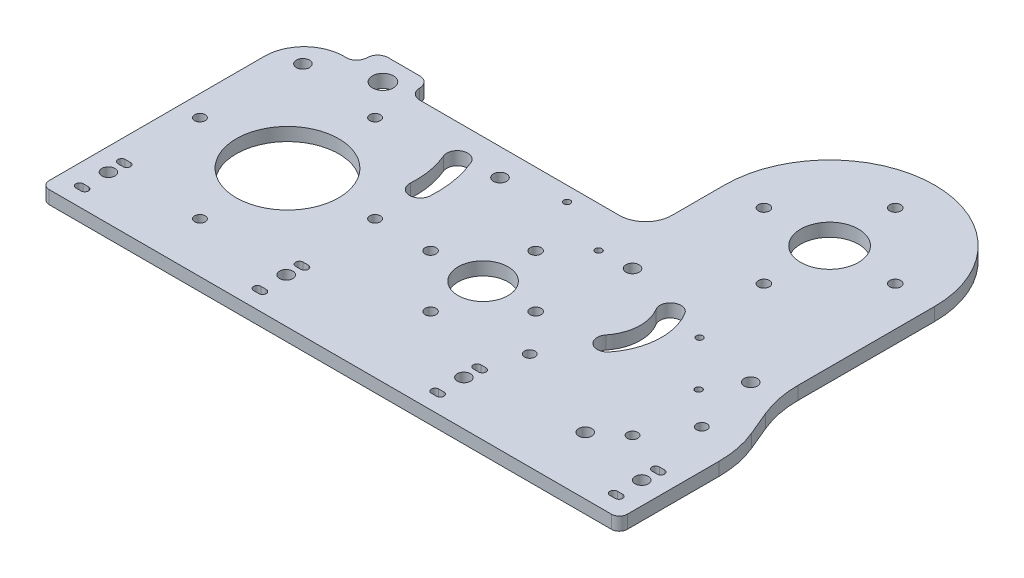
from build123d import *

# Parameters (mm, degrees)
SKETCH1_R           = 19.5
SKETCH1_R_2         = 2.1
SKETCH1_R_3         = 2
SKETCH1_R_4         = 2.5
SKETCH1_R_5         = 9.5
SKETCH1_R_6         = 1.25
SKETCH1_R_7         = 11
BOSS_EXTRUDE1_DEPTH = 5
SKETCH15_R          = 2
CUT_EXTRUDE14_DEPTH = 10
SKETCH18_R          = 2.5
CUT_EXTRUDE15_DEPTH = 483.844656179
FILLET2_R           = 40
FILLET3_R           = 40
SKETCH21_W          = 20
SKETCH21_H          = 8
BOSS_EXTRUDE3_DEPTH = 5
SKETCH20_R          = 4
CUT_EXTRUDE17_DEPTH = 279.07373123
FILLET4_R           = 4
FILLET5_R           = 3


with BuildPart() as part:
    # Sketch1 → Boss-Extrude1 (new body)
    with BuildSketch(Plane(origin=(0, 0, 0), x_dir=(1, 0, 0), z_dir=(0, 1, 0))):
        with BuildLine():
            Line((0, 85), (0, 0))
            Line((0, 0), (220, 0))
            Line((220, 0), (220, 46))
            Line((220, 46), (210, 70))
            Line((210, 70), (210, 130))
            ThreePointArc((210, 130), (170, 170), (130, 130))
            Line((130, 130), (130, 110))
            ThreePointArc((130, 110), (127.071067812, 102.928932188), (120, 100))
            Line((120, 100), (15, 100))
            ThreePointArc((15, 100), (4.393398282, 95.606601718), (0, 85))
        make_face()
        with Locations(Location((41.3, 52.378949376, 0), (0, 0, 270))):
            Circle(SKETCH1_R, mode=Mode.SUBTRACT)
        with Locations(Location((95.75, 52.378949376, 0), (0, 0, 270))):
            Circle(SKETCH1_R_2, mode=Mode.SUBTRACT)
        with BuildLine():
            ThreePointArc((74.29628188, 89.247443853), (77.033008956, 80.00277522), (77.543356768, 70.375048681))
            ThreePointArc((77.543356768, 70.375048681), (73.293969575, 66.641055044), (69.559975938, 70.890442238))
            ThreePointArc((69.559975938, 70.890442238), (69.148853816, 78.646273201), (66.944221964, 86.093523278))
            ThreePointArc((66.944221964, 86.093523278), (69.043291634, 91.346513523), (74.29628188, 89.247443853))
        make_face(mode=Mode.SUBTRACT)
        with Locations(Location((115.75, 32.378949376, 0), (0, 0, 270))):
            Circle(SKETCH1_R_2, mode=Mode.SUBTRACT)
        with Locations(Location((148.636752457, 37.233182234, 0), (0, 0, 270))):
            Circle(SKETCH1_R_3, mode=Mode.SUBTRACT)
        with Locations(Location((185, 22, 0), (0, 0, 270))):
            Circle(SKETCH1_R_4, mode=Mode.SUBTRACT)
        with Locations(Location((195, 30, 0), (0, 0, 270))):
            Circle(SKETCH1_R_3, mode=Mode.SUBTRACT)
        with Locations(Location((115.75, 52.378949376, 0), (0, 0, 270))):
            Circle(SKETCH1_R_5, mode=Mode.SUBTRACT)
        with Locations(Location((135.75, 52.378949376, 0), (0, 0, 270))):
            Circle(SKETCH1_R_2, mode=Mode.SUBTRACT)
        with Locations(Location((115.75, 72.378949376, 0), (0, 0, 270))):
            Circle(SKETCH1_R_2, mode=Mode.SUBTRACT)
        with Locations(Location((127.63485968, 84.474011316, 0), (0, 0, 270))):
            Circle(SKETCH1_R_6, mode=Mode.SUBTRACT)
        with BuildLine():
            ThreePointArc((164.775508993, 80.152802956), (168.201540304, 66.369956658), (163.138904602, 53.100658923))
            ThreePointArc((163.138904602, 53.100658923), (157.520629535, 52.441124786), (156.861095398, 58.059399852))
            ThreePointArc((156.861095398, 58.059399852), (160.216140339, 66.853058501), (157.94568485, 75.987049461))
            ThreePointArc((157.94568485, 75.987049461), (159.277720174, 81.48483828), (164.775508993, 80.152802956))
        make_face(mode=Mode.SUBTRACT)
        with Locations(Location((140, 85, 0), (0, 0, 270))):
            Circle(SKETCH1_R_4, mode=Mode.SUBTRACT)
        with Locations(Location((192.472842847, 57.698975127, 0), (0, 0, 270))):
            Circle(SKETCH1_R_6, mode=Mode.SUBTRACT)
        with Locations(Location((205.365861758, 46, 0), (0, 0, 270))):
            Circle(SKETCH1_R_3, mode=Mode.SUBTRACT)
        with Locations(Location((175.551473485, 74.952011351, 0), (0, 0, 270))):
            Circle(SKETCH1_R_6, mode=Mode.SUBTRACT)
        with Locations(Location((200, 70, 0), (0, 0, 270))):
            Circle(SKETCH1_R_4, mode=Mode.SUBTRACT)
        with Locations(Location((9.83558927, 89.725342507, 0), (0, 0, 270))):
            Circle(SKETCH1_R_4, mode=Mode.SUBTRACT)
        with Locations(Location((84.83558927, 89.725342507, 0), (0, 0, 270))):
            Circle(SKETCH1_R_4, mode=Mode.SUBTRACT)
        with Locations(Location((105.63485968, 94.474011316, 0), (0, 0, 270))):
            Circle(SKETCH1_R_6, mode=Mode.SUBTRACT)
        with Locations(Location((170, 105, 0), (0, 0, 270))):
            Circle(SKETCH1_R_2, mode=Mode.SUBTRACT)
        with Locations(Location((145, 130, 0), (0, 0, 270))):
            Circle(SKETCH1_R_2, mode=Mode.SUBTRACT)
        with Locations(Location((170, 130, 0), (0, 0, 270))):
            Circle(SKETCH1_R_7, mode=Mode.SUBTRACT)
        with Locations(Location((195, 130, 0), (0, 0, 270))):
            Circle(SKETCH1_R_2, mode=Mode.SUBTRACT)
        with Locations(Location((170, 155, 0), (0, 0, 270))):
            Circle(SKETCH1_R_2, mode=Mode.SUBTRACT)
    extrude(amount=BOSS_EXTRUDE1_DEPTH)

    # Sketch15 → Cut-Extrude14 (cut)
    with BuildSketch(Plane(origin=(0, 5, 0), x_dir=(1, 0, 0), z_dir=(0, 1, 0))):
        with Locations(Location((41.3, 85.711963041, 0), (0, 0, 270))):
            Circle(SKETCH15_R)
        with Locations(Location((74.633013665, 52.378949376, 0), (0, 0, 270))):
            Circle(SKETCH15_R)
        with Locations(Location((41.3, 19.045935711, 0), (0, 0, 270))):
            Circle(SKETCH15_R)
        with Locations(Location((7.966986335, 52.378949376, 0), (0, 0, 270))):
            Circle(SKETCH15_R)
    extrude(amount=-CUT_EXTRUDE14_DEPTH, mode=Mode.SUBTRACT)

    # Sketch18 → Cut-Extrude15 (cut, through all)
    with BuildSketch(Plane(origin=(300.638016231, 0, 207.797227621), x_dir=(-1, 0, 0), z_dir=(0, -1, 0))):
        with Locations(Location((292.118016257, 224.797227621, 0), (0, 0, 90))):
            Circle(SKETCH18_R)
        with Locations(Location((224.458016257, 224.797227621, 0), (0, 0, 90))):
            Circle(SKETCH18_R)
        with Locations(Location((156.798016257, 224.797227621, 0), (0, 0, 90))):
            Circle(SKETCH18_R)
        with Locations(Location((89.138016257, 224.797227621, 0), (0, 0, 90))):
            Circle(SKETCH18_R)
        with BuildLine():
            Line((293.118016257, 229.397227621), (291.118016257, 229.397227621))
            ThreePointArc((291.118016257, 229.397227621), (289.718016257, 230.797227621), (291.118016257, 232.197227621))
            Line((291.118016257, 232.197227621), (293.118016257, 232.197227621))
            ThreePointArc((293.118016257, 232.197227621), (294.518016257, 230.797227621), (293.118016257, 229.397227621))
        make_face()
        with BuildLine():
            Line((293.118016257, 213.397227621), (291.118016257, 213.397227621))
            ThreePointArc((291.118016257, 213.397227621), (289.718016257, 214.797227621), (291.118016257, 216.197227621))
            Line((291.118016257, 216.197227621), (293.118016257, 216.197227621))
            ThreePointArc((293.118016257, 216.197227621), (294.518016257, 214.797227621), (293.118016257, 213.397227621))
        make_face()
        with BuildLine():
            Line((225.458016257, 229.397227621), (223.458016257, 229.397227621))
            ThreePointArc((223.458016257, 229.397227621), (222.058016257, 230.797227621), (223.458016257, 232.197227621))
            Line((223.458016257, 232.197227621), (225.458016257, 232.197227621))
            ThreePointArc((225.458016257, 232.197227621), (226.858016257, 230.797227621), (225.458016257, 229.397227621))
        make_face()
        with BuildLine():
            Line((225.458016257, 213.397227621), (223.458016257, 213.397227621))
            ThreePointArc((223.458016257, 213.397227621), (222.058016257, 214.797227621), (223.458016257, 216.197227621))
            Line((223.458016257, 216.197227621), (225.458016257, 216.197227621))
            ThreePointArc((225.458016257, 216.197227621), (226.858016257, 214.797227621), (225.458016257, 213.397227621))
        make_face()
        with BuildLine():
            Line((157.798016257, 229.397227621), (155.798016257, 229.397227621))
            ThreePointArc((155.798016257, 229.397227621), (154.398016257, 230.797227621), (155.798016257, 232.197227621))
            Line((155.798016257, 232.197227621), (157.798016257, 232.197227621))
            ThreePointArc((157.798016257, 232.197227621), (159.198016257, 230.797227621), (157.798016257, 229.397227621))
        make_face()
        with BuildLine():
            Line((157.798016257, 213.397227621), (155.798016257, 213.397227621))
            ThreePointArc((155.798016257, 213.397227621), (154.398016257, 214.797227621), (155.798016257, 216.197227621))
            Line((155.798016257, 216.197227621), (157.798016257, 216.197227621))
            ThreePointArc((157.798016257, 216.197227621), (159.198016257, 214.797227621), (157.798016257, 213.397227621))
        make_face()
        with BuildLine():
            Line((90.138016257, 229.697227621), (88.138016257, 229.697227621))
            ThreePointArc((88.138016257, 229.697227621), (86.738016257, 231.097227621), (88.138016257, 232.497227621))
            Line((88.138016257, 232.497227621), (90.138016257, 232.497227621))
            ThreePointArc((90.138016257, 232.497227621), (91.538016257, 231.097227621), (90.138016257, 229.697227621))
        make_face()
        with BuildLine():
            Line((90.138016257, 213.697227621), (88.138016257, 213.697227621))
            ThreePointArc((88.138016257, 213.697227621), (86.738016257, 215.097227621), (88.138016257, 216.497227621))
            Line((88.138016257, 216.497227621), (90.138016257, 216.497227621))
            ThreePointArc((90.138016257, 216.497227621), (91.538016257, 215.097227621), (90.138016257, 213.697227621))
        make_face()
    extrude(amount=-CUT_EXTRUDE15_DEPTH, mode=Mode.SUBTRACT)

    # Fillet2
    fillet2_edges = [part.edges().sort_by_distance(p)[0] for p in [
        (210, 2.5, -70),
    ]]
    fillet(fillet2_edges, radius=FILLET2_R)

    # Fillet3
    fillet3_edges = [part.edges().sort_by_distance(p)[0] for p in [
        (220, 2.5, -46),
    ]]
    fillet(fillet3_edges, radius=FILLET3_R)

    # Sketch21 → Boss-Extrude3 (add)
    with BuildSketch(Plane.XZ):
        with Locations((30, -104)):
            Rectangle(SKETCH21_W, SKETCH21_H)
    extrude(amount=-BOSS_EXTRUDE3_DEPTH)

    # Sketch20 → Cut-Extrude17 (cut, through all)
    with BuildSketch(Plane(origin=(0, 0, 0), x_dir=(-1, 0, 0), z_dir=(0, -1, 0))):
        with Locations(Location((-31, 99, 0), (0, 0, 90))):
            Circle(SKETCH20_R)
    extrude(amount=-CUT_EXTRUDE17_DEPTH, mode=Mode.SUBTRACT)

    # Fillet4
    fillet4_edges = [part.edges().sort_by_distance(p)[0] for p in [
        (40, 2.5, -100),
        (20, 2.5, -100),
    ]]
    fillet(fillet4_edges, radius=FILLET4_R)
    fillet4_2_edges = [part.edges().sort_by_distance(p)[0] for p in [
        (40, 2.5, -108),
        (20, 2.5, -108),
    ]]
    fillet(fillet4_2_edges, radius=FILLET4_R - 0.0001)  # a hair under: the kernel refuses the full size

    # Fillet5
    fillet5_edges = [part.edges().sort_by_distance(p)[0] for p in [
        (220, 2.5, 0),
        (0, 2.5, 0),
    ]]
    fillet(fillet5_edges, radius=FILLET5_R)


solid = part.part
